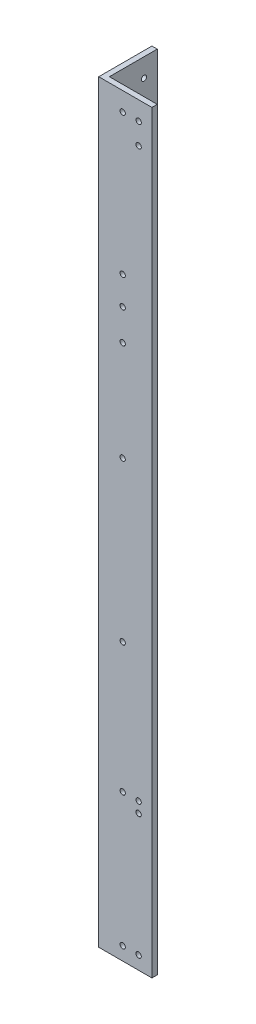
from build123d import *

# Parameters (mm, degrees)
BOSS_EXTRUDE1_DEPTH               = 450
FRONTSIDEHOLES_SKETCH3_R          = 1.5875
FRONTSIDEHOLES_CUT_EXTRUDE1_DEPTH = 3.175
LEFTSIDEHOLES_SKETCH4_R           = 1.5875
LEFTSIDEHOLES_CUT_EXTRUDE2_DEPTH  = 3.175


with BuildPart() as part:
    # Sketch2 → Boss-Extrude1 (new body)
    with BuildSketch(Plane(origin=(0, 0, 0), x_dir=(1, 0, 0), z_dir=(0, 1, 0))):
        Polygon((0, 31.75), (3.175, 31.75), (3.175, 3.175), (31.75, 3.175), (31.75, 0), (0, 0), align=None)
    extrude(amount=BOSS_EXTRUDE1_DEPTH)

    # FrontSideHoles-Sketch3 → FrontSideHoles-Cut-Extrude1 (cut)
    with BuildSketch(Plane.XY):
        with Locations((23.8125, 81.1125)):
            Circle(FRONTSIDEHOLES_SKETCH3_R)
        with Locations((14.2875, 87.4625)):
            Circle(FRONTSIDEHOLES_SKETCH3_R)
        with Locations((23.8125, 87.4625)):
            Circle(FRONTSIDEHOLES_SKETCH3_R)
        with Locations((14.2875, 438.8875)):
            Circle(FRONTSIDEHOLES_SKETCH3_R)
        with Locations((23.8125, 438.8875)):
            Circle(FRONTSIDEHOLES_SKETCH3_R)
        with Locations((23.8125, 426.1875)):
            Circle(FRONTSIDEHOLES_SKETCH3_R)
        with Locations((14.2875, 338.177644)):
            Circle(FRONTSIDEHOLES_SKETCH3_R)
        with Locations((14.2875, 319.652644)):
            Circle(FRONTSIDEHOLES_SKETCH3_R)
        with Locations((14.2875, 260)):
            Circle(FRONTSIDEHOLES_SKETCH3_R)
        with Locations((14.2875, 165)):
            Circle(FRONTSIDEHOLES_SKETCH3_R)
        with Locations((14.2875, 355)):
            Circle(FRONTSIDEHOLES_SKETCH3_R)
        with Locations((14.2875, 7.9375)):
            Circle(FRONTSIDEHOLES_SKETCH3_R)
        with Locations((23.8125, 7.9375)):
            Circle(FRONTSIDEHOLES_SKETCH3_R)
    extrude(amount=-FRONTSIDEHOLES_CUT_EXTRUDE1_DEPTH, mode=Mode.SUBTRACT)

    # LeftSideHoles-Sketch4 → LeftSideHoles-Cut-Extrude2 (cut)
    with BuildSketch(Plane.ZY):
        with Locations((-23.8125, 81.1125)):
            Circle(LEFTSIDEHOLES_SKETCH4_R)
        with Locations((-14.2875, 81.1125)):
            Circle(LEFTSIDEHOLES_SKETCH4_R)
        with Locations((-23.8125, 87.4625)):
            Circle(LEFTSIDEHOLES_SKETCH4_R)
        with Locations((-23.8125, 438.8875)):
            Circle(LEFTSIDEHOLES_SKETCH4_R)
        with Locations((-23.8125, 426.1875)):
            Circle(LEFTSIDEHOLES_SKETCH4_R)
        with Locations((-14.2875, 426.1875)):
            Circle(LEFTSIDEHOLES_SKETCH4_R)
        with Locations((-23.8125, 332.602644)):
            Circle(LEFTSIDEHOLES_SKETCH4_R)
        with Locations((-14.2875, 332.602644)):
            Circle(LEFTSIDEHOLES_SKETCH4_R)
        with Locations((-23.8125, 319.902644)):
            Circle(LEFTSIDEHOLES_SKETCH4_R)
        with Locations((-14.2875, 319.902644)):
            Circle(LEFTSIDEHOLES_SKETCH4_R)
        with Locations((-23.8125, 7.9375)):
            Circle(LEFTSIDEHOLES_SKETCH4_R)
        with Locations((-14.2875, 7.9375)):
            Circle(LEFTSIDEHOLES_SKETCH4_R)
        with Locations((-14.2875, 165)):
            Circle(LEFTSIDEHOLES_SKETCH4_R)
        with Locations((-14.2875, 260)):
            Circle(LEFTSIDEHOLES_SKETCH4_R)
        with Locations((-14.2875, 355)):
            Circle(LEFTSIDEHOLES_SKETCH4_R)
    extrude(amount=-LEFTSIDEHOLES_CUT_EXTRUDE2_DEPTH, mode=Mode.SUBTRACT)


solid = part.part
